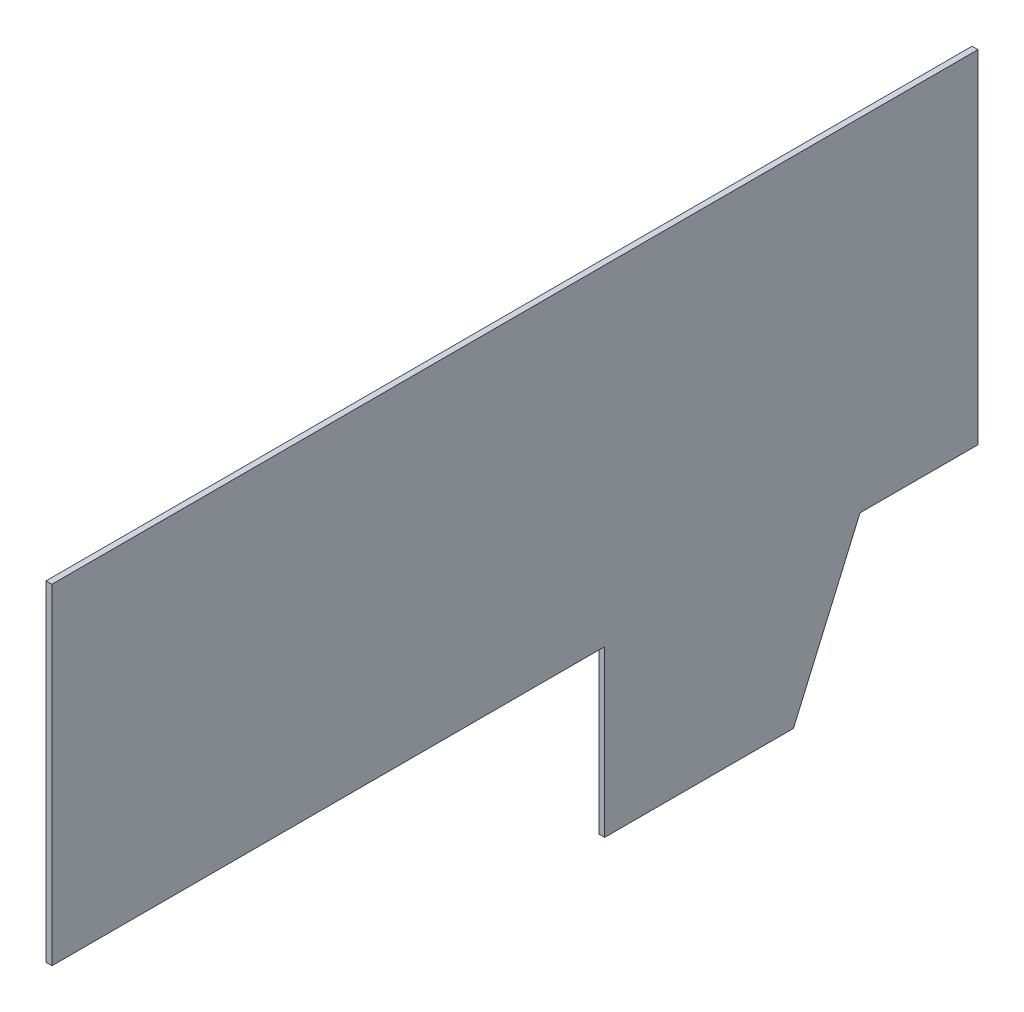
from build123d import *

# Parameters (mm, degrees)
SKETCH1_W           = 498.348
SKETCH1_H           = 177.8
BOSS_EXTRUDE1_DEPTH = 1.5875
BOSS_EXTRUDE2_DEPTH = 3.175


with BuildPart() as part:
    # Sketch1 → Boss-Extrude1 (new, symmetric)
    with BuildSketch(Plane(origin=(0, 0, 0), x_dir=(0, 0, -1), z_dir=(1, 0, 0))):
        Rectangle(SKETCH1_W, SKETCH1_H)
    extrude(amount=BOSS_EXTRUDE1_DEPTH, both=True)

    # Sketch2 → Boss-Extrude2 (add)
    with BuildSketch(Plane(origin=(1.5875, 0, 0), x_dir=(0, 0, -1), z_dir=(1, 0, 0))):
        Polygon((249.174, -95.25), (249.174, -88.9), (48.2854, -88.9), (48.2854, -177.8), (149.8854, -177.8), (185.674, -95.25), align=None)
    extrude(amount=-BOSS_EXTRUDE2_DEPTH)


solid = part.part
